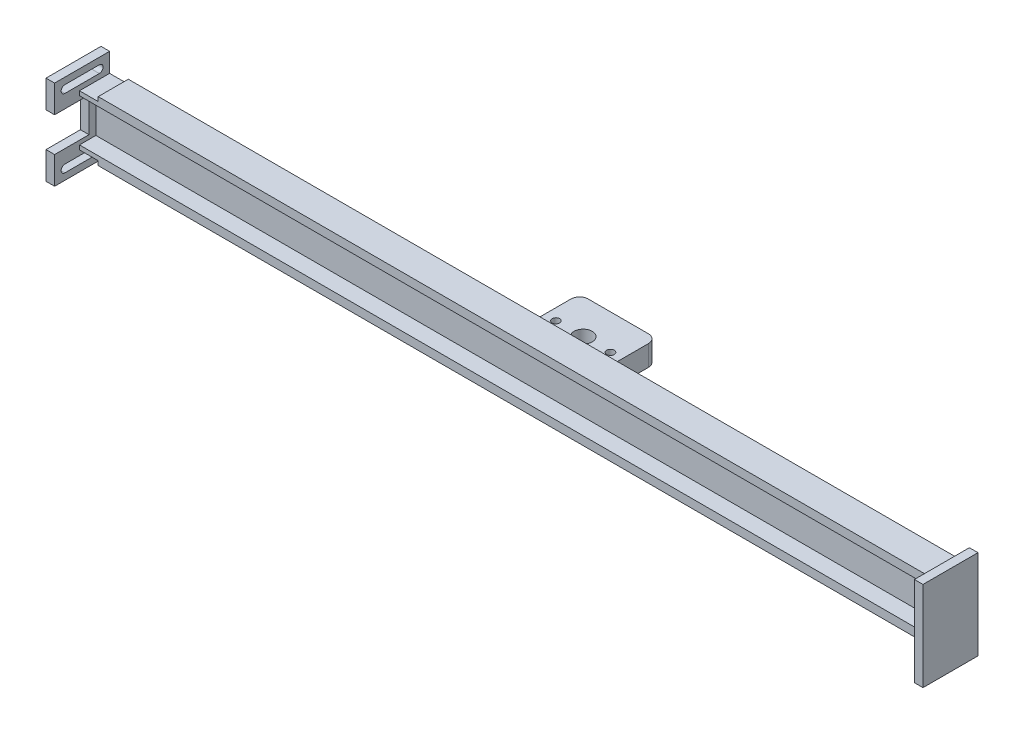
from build123d import *

# Parameters (mm, degrees)
BOSS_EXTRUDE1_DEPTH = 250
SKETCH16_W          = 22.5
SKETCH16_H          = 25.4
SKETCH16_R          = 1.1
SKETCH16_R_2        = 2.65
BOSS_EXTRUDE4_DEPTH = 6
SKETCH17_W          = 22.5
SKETCH17_H          = 6
CUT_EXTRUDE10_DEPTH = 2.5
SKETCH20_W          = 26
SKETCH20_H          = 16
BOSS_EXTRUDE7_DEPTH = 2.5
CUT_EXTRUDE12_DEPTH = 2.5
SKETCH22_W          = 10
SKETCH22_H          = 10
CUT_EXTRUDE13_DEPTH = 10
SKETCH23_W          = 5.437321705
SKETCH23_H          = 8.7625
CUT_EXTRUDE14_DEPTH = 1.25
SKETCH24_W          = 26
SKETCH24_H          = 16
BOSS_EXTRUDE8_DEPTH = 2.5
FILLET1_R           = 2.5


with BuildPart() as part:
    # Sketch1 → Boss-Extrude1 (new body)
    with BuildSketch(Plane.YZ):
        Polygon((0, 4.7625), (-2.5, 4.7625), (-2.5, -4), (14.8825, -4), (14.8825, 4.7625), (12.3825, 4.7625), (12.3825, 0), (0, 0), align=None)
    extrude(amount=BOSS_EXTRUDE1_DEPTH)

    # Sketch16 → Boss-Extrude4 (add)
    with BuildSketch(Plane.XZ.offset(2.5)):
        with Locations((125, -16.7)):
            Rectangle(SKETCH16_W, SKETCH16_H)
        with Locations((117.0625, -16.7)):
            Circle(SKETCH16_R, mode=Mode.SUBTRACT)
        with Locations((132.9375, -16.7)):
            Circle(SKETCH16_R, mode=Mode.SUBTRACT)
        with Locations((125, -16.7)):
            Circle(SKETCH16_R_2, mode=Mode.SUBTRACT)
    extrude(amount=-BOSS_EXTRUDE4_DEPTH)

    # Sketch17 → Cut-Extrude10 (cut)
    with BuildSketch(Plane(origin=(0, 0, -29.4), x_dir=(1, 0, 0), z_dir=(0, 0, -1))):
        with Locations((125, -0.5)):
            Rectangle(SKETCH17_W, SKETCH17_H)
    extrude(amount=-CUT_EXTRUDE10_DEPTH, mode=Mode.SUBTRACT)

    # Sketch20 → Boss-Extrude7 (add)
    with BuildSketch(Plane(origin=(0, 0, 0), x_dir=(0, -1, 0), z_dir=(-1, 0, 0))):
        with Locations((-6.19125, 4)):
            Rectangle(SKETCH20_W, SKETCH20_H)
    extrude(amount=BOSS_EXTRUDE7_DEPTH)

    # Sketch21 → Cut-Extrude12 (cut)
    with BuildSketch(Plane(origin=(-2.5, 0, 0), x_dir=(0, -1, 0), z_dir=(-1, 0, 0))):
        with BuildLine():
            Line((-15.09125, 9), (-15.09125, -1))
            ThreePointArc((-15.09125, -1), (-16.19125, -2.1), (-17.29125, -1))
            Line((-17.29125, -1), (-17.29125, 9))
            ThreePointArc((-17.29125, 9), (-16.19125, 10.1), (-15.09125, 9))
        make_face()
        with BuildLine():
            Line((2.70875, 9), (2.70875, -1))
            ThreePointArc((2.70875, -1), (3.80875, -2.1), (4.90875, -1))
            Line((4.90875, -1), (4.90875, 9))
            ThreePointArc((4.90875, 9), (3.80875, 10.1), (2.70875, 9))
        make_face()
    extrude(amount=-CUT_EXTRUDE12_DEPTH, mode=Mode.SUBTRACT)

    # Sketch22 → Cut-Extrude13 (cut)
    with BuildSketch(Plane(origin=(-2.5, 0, 0), x_dir=(0, -1, 0), z_dir=(-1, 0, 0))):
        with Locations((-6.19125, 7)):
            Rectangle(SKETCH22_W, SKETCH22_H)
    extrude(amount=-CUT_EXTRUDE13_DEPTH, mode=Mode.SUBTRACT)

    # Sketch23 → Cut-Extrude14 (cut)
    with BuildSketch(Plane(origin=(0, 14.8825, 0), x_dir=(-1, 0, 0), z_dir=(0, 1, 0))):
        with Locations((-2.718660853, 0.38125)):
            Rectangle(SKETCH23_W, SKETCH23_H)
    cut_extrude14 = extrude(amount=-CUT_EXTRUDE14_DEPTH, mode=Mode.SUBTRACT)

    # Mirror8: Cut-Extrude14 across plane
    add(cut_extrude14.mirror(Plane.ZX.offset(6.19125)), mode=Mode.SUBTRACT)

    # Sketch24 → Boss-Extrude8 (add)
    with BuildSketch(Plane.YZ.offset(250)):
        with Locations((6.19125, 4)):
            Rectangle(SKETCH24_W, SKETCH24_H)
    extrude(amount=BOSS_EXTRUDE8_DEPTH)

    # Fillet1
    fillet1_edges = [part.edges().sort_by_distance(p)[0] for p in [
        (136.25, 0.5, -26.9),
        (113.75, 0.5, -26.9),
    ]]
    fillet(fillet1_edges, radius=FILLET1_R)


solid = part.part
